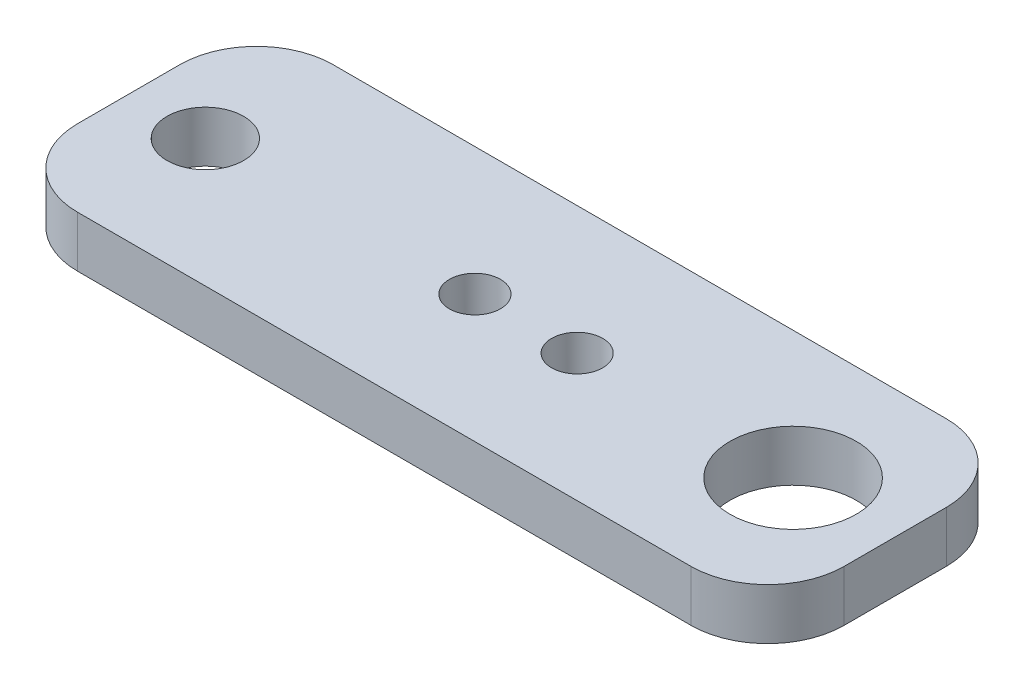
from build123d import *

# Parameters (mm, degrees)
SKETCH1_W                = 30
SKETCH1_H                = 10
BOSS_EXTRUDE1_DEPTH      = 2
SKETCH2_R                = 2.472864358
SKETCH2_R_2              = 1
CUT_EXTRUDE1_DEPTH       = 3
FILLET1_R                = 3
F_3_0_3_DIAMETER_HOLE1_D = 3


with BuildPart() as part:
    # Sketch1 → Boss-Extrude1 (new body)
    with BuildSketch(Plane(origin=(0, 0, 0), x_dir=(1, 0, 0), z_dir=(0, 1, 0))):
        Rectangle(SKETCH1_W, SKETCH1_H)
    extrude(amount=BOSS_EXTRUDE1_DEPTH)

    # Sketch2 → Cut-Extrude1 (cut)
    with BuildSketch(Plane(origin=(0, 2, 0), x_dir=(1, 0, 0), z_dir=(0, 1, 0))):
        with Locations((11, 0)):
            Circle(SKETCH2_R)
        with Locations((2.55, 0)):
            Circle(SKETCH2_R_2)
        with Locations((-1.45, 0)):
            Circle(SKETCH2_R_2)
    extrude(amount=-CUT_EXTRUDE1_DEPTH, mode=Mode.SUBTRACT)

    # Fillet1
    fillet1_edges = [part.edges().sort_by_distance(p)[0] for p in [
        (15, 1, 5),
        (15, 1, -5),
        (-15, 1, -5),
        (-15, 1, 5),
    ]]
    fillet(fillet1_edges, radius=FILLET1_R)

    # Ø3.0 (3) Diameter Hole1 (through all)
    with Locations(Plane(origin=(0, 2, 0), x_dir=(1, 0, 0), z_dir=(0, 1, 0))):
        with Locations((-12, 0)):
            Hole(F_3_0_3_DIAMETER_HOLE1_D / 2)


solid = part.part
